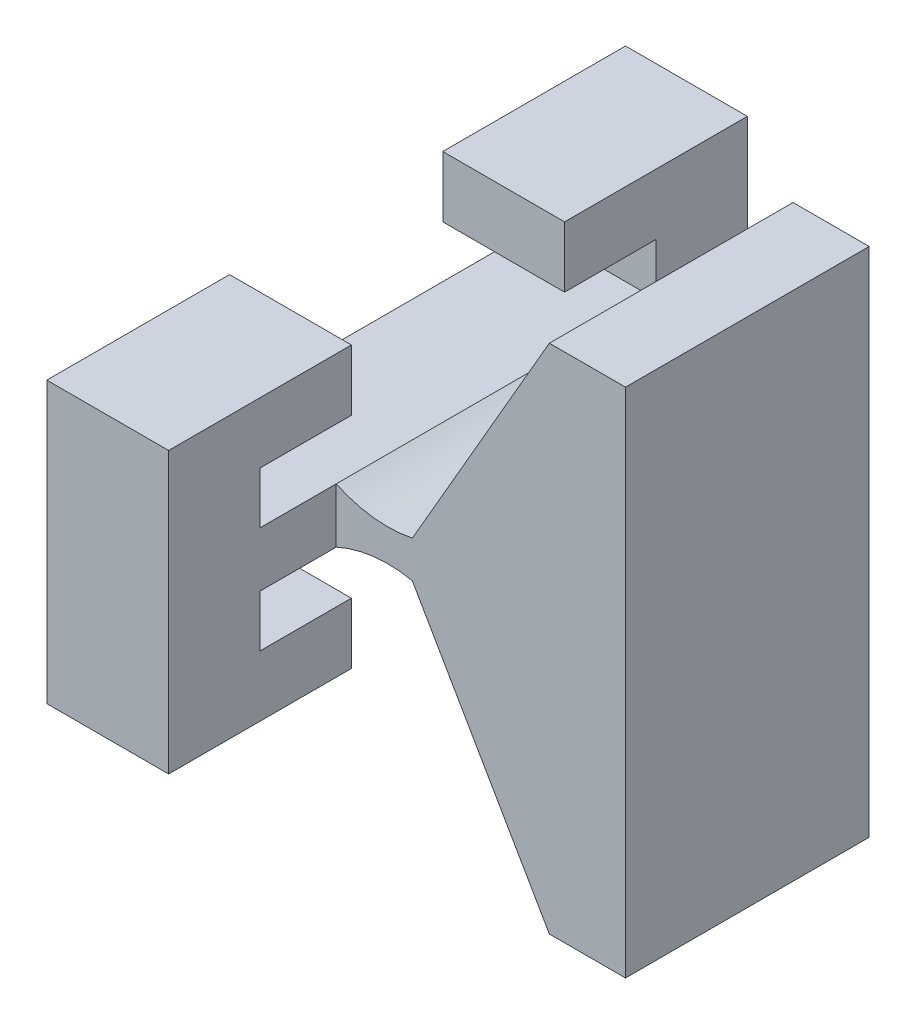
from build123d import *

# Parameters (mm, degrees)
EXTRUDE_1_DEPTH          = 4
SKETCH_3_W               = 4
SKETCH_3_H               = 1.8
EXTRUDE_2_DEPTH          = 5.5
SKETCH_5_W               = 4
SKETCH_5_H               = 3
EXTRUDE_3_DEPTH          = 3.7
MIRROR_3_COPY_1_SKETCH_W = 4
MIRROR_3_COPY_1_SKETCH_H = 3
MIRROR_3_COPY_1_DEPTH    = 3.7
MIRROR_3_COPY_2_SKETCH_W = 4
MIRROR_3_COPY_2_SKETCH_H = 3
MIRROR_3_COPY_2_DEPTH    = 3.7
SKETCH_7_W               = 4
SKETCH_7_H               = 2
EXTRUDE_4_DEPTH          = 3
MIRROR_5_COPY_1_SKETCH_W = 4
MIRROR_5_COPY_1_SKETCH_H = 2
MIRROR_5_COPY_1_DEPTH    = 3
MIRROR_5_COPY_2_SKETCH_W = 4
MIRROR_5_COPY_2_SKETCH_H = 2
MIRROR_5_COPY_2_DEPTH    = 3


with BuildPart() as part:
    # Эскиз2 → Бобышка-Вытянуть1 (new, symmetric)
    with BuildSketch(Plane.XY):
        with BuildLine():
            Line((0, 0), (0, 0.9))
            Line((0, 0.9), (4, 0.9))
            ThreePointArc((4, 0.9), (5.226251594, 0.551100379), (6.5, 0.605771366))
            Line((6.5, 0.605771366), (11, 8.4))
            Line((11, 8.4), (13.5, 8.4))
            Line((13.5, 8.4), (13.5, -8.4))
            Line((13.5, -8.4), (11, -8.4))
            Line((11, -8.4), (6.5, -0.605771366))
            ThreePointArc((6.5, -0.605771366), (5.226251594, -0.551100379), (4, -0.9))
            Line((4, -0.9), (0, -0.9))
            Line((0, -0.9), (0, 0))
        make_face()
    extrude(amount=EXTRUDE_1_DEPTH, both=True)

    # Эскиз3 → Бобышка-Вытянуть2 (add)
    with BuildSketch(Plane(origin=(0, 0, -4), x_dir=(-1, 0, 0), z_dir=(0, 0, -1))):
        with Locations((-2, 0)):
            Rectangle(SKETCH_3_W, SKETCH_3_H)
    extrude_2 = extrude(amount=EXTRUDE_2_DEPTH)

    # Зеркальное отражение1: Бобышка-Вытянуть2 across plane
    add(extrude_2.mirror(Plane.XY))

    # Эскиз5 → Бобышка-Вытянуть3 (add)
    with BuildSketch(Plane(origin=(0, 0.9, 0), x_dir=(1, 0, 0), z_dir=(0, 1, 0))):
        with Locations((2, 8)):
            Rectangle(SKETCH_5_W, SKETCH_5_H)
    extrude_3 = extrude(amount=EXTRUDE_3_DEPTH)

    # Зеркальное отражение2: Бобышка-Вытянуть3 across plane
    add(extrude_3.mirror(Plane.XY))

    # Зеркальное отражение3 copy 1 sketch → Зеркальное отражение3 copy 1 (add)
    with BuildSketch(Plane.XZ.offset(0.9)):
        with Locations((2, 8)):
            Rectangle(MIRROR_3_COPY_1_SKETCH_W, MIRROR_3_COPY_1_SKETCH_H)
    extrude(amount=MIRROR_3_COPY_1_DEPTH)

    # Зеркальное отражение3 copy 2 sketch → Зеркальное отражение3 copy 2 (add)
    with BuildSketch(Plane.XZ.offset(0.9)):
        with Locations((2, -8)):
            Rectangle(MIRROR_3_COPY_2_SKETCH_W, MIRROR_3_COPY_2_SKETCH_H)
    extrude(amount=MIRROR_3_COPY_2_DEPTH)

    # Эскиз7 → Бобышка-Вытянуть4 (add)
    with BuildSketch(Plane(origin=(0, 0, 6.5), x_dir=(-1, 0, 0), z_dir=(0, 0, -1))):
        with Locations((-2, 3.6)):
            Rectangle(SKETCH_7_W, SKETCH_7_H)
    extrude_4 = extrude(amount=EXTRUDE_4_DEPTH)

    # Зеркальное отражение4: Бобышка-Вытянуть4 across plane
    add(extrude_4.mirror(Plane.XY))

    # Зеркальное отражение5 copy 1 sketch → Зеркальное отражение5 copy 1 (add)
    with BuildSketch(Plane(origin=(0, 0, -6.5), x_dir=(-1, 0, 0), z_dir=(0, 0, 1))):
        with Locations((-2, 3.6)):
            Rectangle(MIRROR_5_COPY_1_SKETCH_W, MIRROR_5_COPY_1_SKETCH_H)
    extrude(amount=MIRROR_5_COPY_1_DEPTH)

    # Зеркальное отражение5 copy 2 sketch → Зеркальное отражение5 copy 2 (add)
    with BuildSketch(Plane(origin=(0, 0, 6.5), x_dir=(-1, 0, 0), z_dir=(0, 0, -1))):
        with Locations((-2, -3.6)):
            Rectangle(MIRROR_5_COPY_2_SKETCH_W, MIRROR_5_COPY_2_SKETCH_H)
    extrude(amount=MIRROR_5_COPY_2_DEPTH)


solid = part.part
